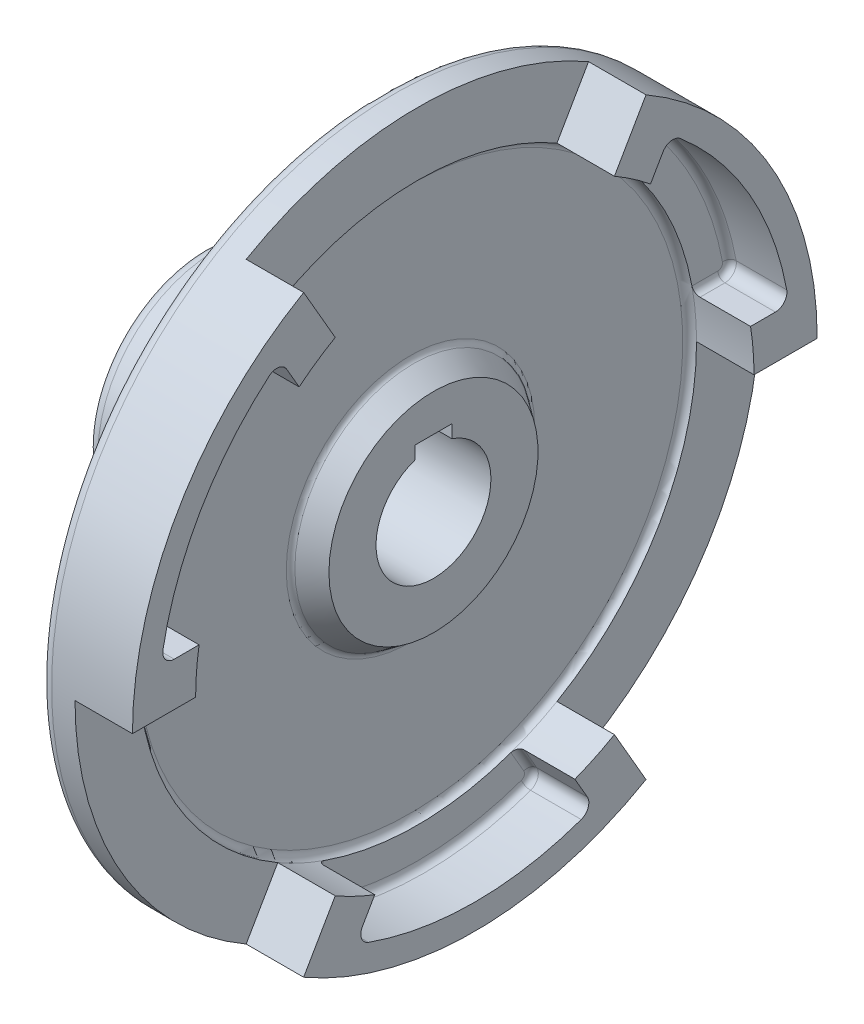
from build123d import *
from build123d.topology import SkipClean

# Parameters (mm, degrees)
EXTRUDE_1_DEPTH          = 25
PATTERN_CIRCULAR_1_COUNT = 3
CUT_EXTRUDE_2_DEPTH      = 234.242363219
FILLET_1_R               = 5
FILLET_2_R               = 3
FILLET_4_R               = 3


# Some blends are built 0.0001 mm under size
with BuildPart() as part:
    # 草圖1 → 旋轉1 (revolve)
    with BuildSketch(Plane.XY, mode=Mode.PRIVATE) as revolve_1_sk:
        Polygon((0, 0), (0, 51), (63, 51), (78.521675152, 149), (93, 149), (93, 121.5), (90, 121.5), (90, 52.5), (100, 45.5), (100, 0), align=None)
    revolve(revolve_1_sk.sketch.rotate(Axis((0, 0, 0), (1, 0, 0)), 90), axis=Axis((0, 0, 0), (1, 0, 0)))

    # 草圖2 → 伸長1 (add)
    with SkipClean():  # the faces are left unmerged after this step: merging them gives an invalid solid
        with BuildSketch(Plane(origin=(93, 0, 0), x_dir=(0, 0, -1), z_dir=(1, 0, 0))):
            with BuildLine():
                Line((-121.5, 0), (-149, 0))
                ThreePointArc((-149, 0), (-129.037785164, 74.5), (-74.5, 129.037785164))
                Line((-74.5, 129.037785164), (-60.75, 105.22208656))
                ThreePointArc((-60.75, 105.22208656), (-68.815526029, 100.133278072), (-76.457086782, 94.427558905))
                Line((-76.457086782, 94.427558905), (-84.797368183, 108.873350041))
                ThreePointArc((-84.797368183, 108.873350041), (-119.511505722, 69), (-136.685771022, 19))
                Line((-136.685771022, 19), (-120.00520822, 19))
                ThreePointArc((-120.00520822, 19), (-121.125725589, 9.52935468), (-121.5, 0))
            make_face()
        extrude_1 = extrude(amount=EXTRUDE_1_DEPTH)

    # 環狀複製排列1: 伸長1 ×3 about axis
    with SkipClean():  # the faces are left unmerged after this step: merging them gives an invalid solid
        pattern_circular_1_axis = Axis((0, 0, 0), (1, 0, 0))
        for i in range(1, PATTERN_CIRCULAR_1_COUNT):
            add(extrude_1.rotate(pattern_circular_1_axis, i * 360 / PATTERN_CIRCULAR_1_COUNT))

    # 草圖3 → 伸長2 (cut, through all)
    with SkipClean():  # the faces are left unmerged after this step: merging them gives an invalid solid
        with BuildSketch(Plane(origin=(100, 0, 0), x_dir=(0, 0, -1), z_dir=(1, 0, 0))):
            with BuildLine():
                Line((8, 23.685438565), (8, 29.3))
                Line((8, 29.3), (-8, 29.3))
                Line((-8, 29.3), (-8, 23.685438565))
                ThreePointArc((-8, 23.685438565), (0, -25), (8, 23.685438565))
            make_face()
        extrude(amount=-CUT_EXTRUDE_2_DEPTH, mode=Mode.SUBTRACT)

    # 圓角1
    fillet_1_edges = [part.edges().sort_by_distance(p)[0] for p in [
        (63, 0, -51),
        (0, 0, -51),
        (105.5, 19, 136.685771022),
        (105.5, 108.873350041, 84.797368183),
        (105.5, 108.873350041, -84.797368183),
        (105.5, 19, -136.685771022),
        (105.5, -127.873350041, -51.888402839),
        (105.5, -127.873350041, 51.888402839),
        (78.521675152, 0, -149),
    ]]
    fillet(fillet_1_edges, radius=FILLET_1_R)

    # 圓角2
    fillet_2_edges = [part.edges().sort_by_distance(p)[0] for p in [
        (90, 0, -52.5),
        (90, 0, -121.5),
    ]]
    fillet(fillet_2_edges, radius=FILLET_2_R - 0.0001)  # a hair under: the kernel refuses the full size

    # 圓角4
    # the kernel refuses this fillet: 3 mm, written as the material it adds along each edge
    with BuildSketch(Plane(origin=(93, -122.790555652, -48.953850131), x_dir=(0, -0.4999999999999997, 0.8660254037844387), z_dir=(0, 0.8660254037844388, 0.4999999999999998))) as fillet_4_piece_1_section:
        with BuildLine():
            CenterArc((FILLET_4_R, FILLET_4_R), FILLET_4_R, 180, 90)
            Line((0, FILLET_4_R), (0, 0))
            Line((0, 0), (FILLET_4_R, 0))
        make_face()
    fillet_4_piece_1 = extrude(amount=18.311457385, mode=Mode.PRIVATE)
    fillet_4_piece_1 = fillet_4_piece_1 - Plane(origin=(93.675428754, 0, 0), x_dir=(0, 0, 1), z_dir=(-1, 0, 0)) * Cylinder(121.5, 49, mode=Mode.PRIVATE)
    add(fillet_4_piece_1)
    with BuildSketch(Plane(origin=(93, -125.290555652, -44.623723112), x_dir=(0, 0.49999999999999956, -0.8660254037844388), z_dir=(0, 0.8660254037844388, 0.49999999999999956))) as fillet_4_piece_2:
        with BuildLine():
            CenterArc((5 - FILLET_4_R, -FILLET_4_R), FILLET_4_R, 0, 90)
            Line((5, -FILLET_4_R), (5, 0))
            Line((5, 0), (5 - FILLET_4_R, 0))
        make_face()
    revolve(axis=Axis((93, -125.290555652, -44.623723112), (-1, 0, 0)), revolution_arc=100.39603782)
    with BuildSketch(Plane(origin=(93, -106.932368377, 39.798121438), x_dir=(0, -0.5000000000000021, -0.8660254037844374), z_dir=(0, -0.8660254037844375, 0.5000000000000022))) as fillet_4_piece_3_section:
        with BuildLine():
            CenterArc((FILLET_4_R, FILLET_4_R), FILLET_4_R, 180, 90)
            Line((0, FILLET_4_R), (0, 0))
            Line((0, 0), (FILLET_4_R, 0))
        make_face()
    fillet_4_piece_3 = extrude(amount=18.311457385, mode=Mode.PRIVATE)
    fillet_4_piece_3 = fillet_4_piece_3 - Plane(origin=(93.675434129, 0, 0), x_dir=(0, 0, 1), z_dir=(-1, 0, 0)) * Cylinder(121.5, 49, mode=Mode.PRIVATE)
    add(fillet_4_piece_3)
    with BuildSketch(Plane(origin=(93, -125.290555652, 44.623723112), x_dir=(0, 0.5000000000000057, 0.8660254037844354), z_dir=(0, 0.8660254037844354, -0.5000000000000057))) as fillet_4_piece_4:
        with BuildLine():
            CenterArc((5 - FILLET_4_R, FILLET_4_R), FILLET_4_R, 270, 90)
            Line((5, FILLET_4_R), (5, 0))
            Line((5, 0), (5 - FILLET_4_R, 0))
        make_face()
    revolve(axis=Axis((93, -125.290555652, 44.623723112), (1, 0, 0)), revolution_arc=100.39603782)
    with BuildSketch(Plane(origin=(93, 103.790555652, -81.862815474), x_dir=(0, -0.5000000000000004, -0.8660254037844384), z_dir=(0, -0.8660254037844384, 0.5000000000000004))) as fillet_4_piece_5_section:
        with BuildLine():
            CenterArc((FILLET_4_R, FILLET_4_R), FILLET_4_R, 180, 90)
            Line((0, FILLET_4_R), (0, 0))
            Line((0, 0), (FILLET_4_R, 0))
        make_face()
    fillet_4_piece_5 = extrude(amount=18.311457385, mode=Mode.PRIVATE)
    fillet_4_piece_5 = fillet_4_piece_5 - Plane(origin=(93.675428754, 0, 0), x_dir=(0, 0, 1), z_dir=(-1, 0, 0)) * Cylinder(121.5, 49, mode=Mode.PRIVATE)
    add(fillet_4_piece_5)
    with BuildSketch(Plane(origin=(93, 101.290555652, -86.192942493), x_dir=(0, 0.49999999999999956, 0.8660254037844388), z_dir=(0, -0.8660254037844388, 0.49999999999999956))) as fillet_4_piece_6:
        with BuildLine():
            CenterArc((5 - FILLET_4_R, -FILLET_4_R), FILLET_4_R, 0, 90)
            Line((5, -FILLET_4_R), (5, 0))
            Line((5, 0), (5 - FILLET_4_R, 0))
        make_face()
    revolve(axis=Axis((93, 101.290555652, -86.192942493), (-1, 0, 0)), revolution_arc=100.39603782)
    with BuildSketch(Plane(origin=(93, 19, -112.50520822), x_dir=(0, 1, 0), z_dir=(0, 0, -1))) as fillet_4_piece_7_section:
        with BuildLine():
            CenterArc((FILLET_4_R, FILLET_4_R), FILLET_4_R, 180, 90)
            Line((0, FILLET_4_R), (0, 0))
            Line((0, 0), (FILLET_4_R, 0))
        make_face()
    fillet_4_piece_7 = extrude(amount=18.311457385, mode=Mode.PRIVATE)
    fillet_4_piece_7 = fillet_4_piece_7 - Plane(origin=(93.675434129, 0, 0), x_dir=(0, 0, 1), z_dir=(-1, 0, 0)) * Cylinder(121.5, 49, mode=Mode.PRIVATE)
    add(fillet_4_piece_7)
    with BuildSketch(Plane(origin=(93, 24, -130.816665605), x_dir=(0, -1, 0), z_dir=(0, 0, 1))) as fillet_4_piece_8:
        with BuildLine():
            CenterArc((5 - FILLET_4_R, FILLET_4_R), FILLET_4_R, 270, 90)
            Line((5, FILLET_4_R), (5, 0))
            Line((5, 0), (5 - FILLET_4_R, 0))
        make_face()
    revolve(axis=Axis((93, 24, -130.816665605), (1, 0, 0)), revolution_arc=100.39603782)
    with BuildSketch(Plane(origin=(93, 19, 130.816665605), x_dir=(0, 1, 0), z_dir=(0, 0, -1))) as fillet_4_piece_9_section:
        with BuildLine():
            CenterArc((FILLET_4_R, FILLET_4_R), FILLET_4_R, 180, 90)
            Line((0, FILLET_4_R), (0, 0))
            Line((0, 0), (FILLET_4_R, 0))
        make_face()
    fillet_4_piece_9 = extrude(amount=18.311457385, mode=Mode.PRIVATE)
    fillet_4_piece_9 = fillet_4_piece_9 - Plane(origin=(93.675428754, 0, 0), x_dir=(0, 0, 1), z_dir=(-1, 0, 0)) * Cylinder(121.5, 49, mode=Mode.PRIVATE)
    add(fillet_4_piece_9)
    with BuildSketch(Plane(origin=(93, 24, 130.816665605), x_dir=(0, -1, 0), z_dir=(0, 0, -1))) as fillet_4_piece_10:
        with BuildLine():
            CenterArc((5 - FILLET_4_R, -FILLET_4_R), FILLET_4_R, 0, 90)
            Line((5, -FILLET_4_R), (5, 0))
            Line((5, 0), (5 - FILLET_4_R, 0))
        make_face()
    revolve(axis=Axis((93, 24, 130.816665605), (-1, 0, 0)), revolution_arc=100.39603782)
    with BuildSketch(Plane(origin=(93, 87.932368377, 72.707086782), x_dir=(0, -0.49999999999999795, 0.8660254037844397), z_dir=(0, 0.8660254037844398, 0.49999999999999806))) as fillet_4_piece_11_section:
        with BuildLine():
            CenterArc((FILLET_4_R, FILLET_4_R), FILLET_4_R, 180, 90)
            Line((0, FILLET_4_R), (0, 0))
            Line((0, 0), (FILLET_4_R, 0))
        make_face()
    fillet_4_piece_11 = extrude(amount=18.311457385, mode=Mode.PRIVATE)
    fillet_4_piece_11 = fillet_4_piece_11 - Plane(origin=(93.675434129, 0, 0), x_dir=(0, 0, 1), z_dir=(-1, 0, 0)) * Cylinder(121.5, 49, mode=Mode.PRIVATE)
    add(fillet_4_piece_11)
    with BuildSketch(Plane(origin=(93, 101.290555652, 86.192942493), x_dir=(0, 0.49999999999999745, -0.86602540378444), z_dir=(0, -0.86602540378444, -0.49999999999999745))) as fillet_4_piece_12:
        with BuildLine():
            CenterArc((5 - FILLET_4_R, FILLET_4_R), FILLET_4_R, 270, 90)
            Line((5, FILLET_4_R), (5, 0))
            Line((5, 0), (5 - FILLET_4_R, 0))
        make_face()
    revolve(axis=Axis((93, 101.290555652, 86.192942493), (1, 0, 0)), revolution_arc=100.39603782)
    with BuildSketch(Plane(origin=(93, 0, 0), x_dir=(0, -0.9420342530245831, 0.33551671512521647), z_dir=(0, 0.33551671512521647, 0.9420342530245831))) as fillet_4_piece_13:
        with BuildLine():
            CenterArc((138 - FILLET_4_R, FILLET_4_R), FILLET_4_R, 270, 90)
            Line((138, FILLET_4_R), (138, 0))
            Line((138, 0), (138 - FILLET_4_R, 0))
        make_face()
    revolve(axis=Axis((93, 0, 0), (1, 0, 0)), revolution_arc=39.20792436)
    with BuildSketch(Plane(origin=(93, 0, 0), x_dir=(0, 0.18045112781954722, -0.9835839519169949), z_dir=(0, -0.9835839519169949, -0.18045112781954722))) as fillet_4_piece_14:
        with BuildLine():
            CenterArc((138 - FILLET_4_R, FILLET_4_R), FILLET_4_R, 270, 90)
            Line((138, FILLET_4_R), (138, 0))
            Line((138, 0), (138 - FILLET_4_R, 0))
        make_face()
    revolve(axis=Axis((93, 0, 0), (1, 0, 0)), revolution_arc=39.20792436)
    with BuildSketch(Plane(origin=(93, 0, 0), x_dir=(0, 0.7615831252050357, 0.6480672367917786), z_dir=(0, 0.6480672367917786, -0.7615831252050357))) as fillet_4_piece_15:
        with BuildLine():
            CenterArc((138 - FILLET_4_R, FILLET_4_R), FILLET_4_R, 270, 90)
            Line((138, FILLET_4_R), (138, 0))
            Line((138, 0), (138 - FILLET_4_R, 0))
        make_face()
    revolve(axis=Axis((93, 0, 0), (1, 0, 0)), revolution_arc=39.20792436)


solid = part.part
